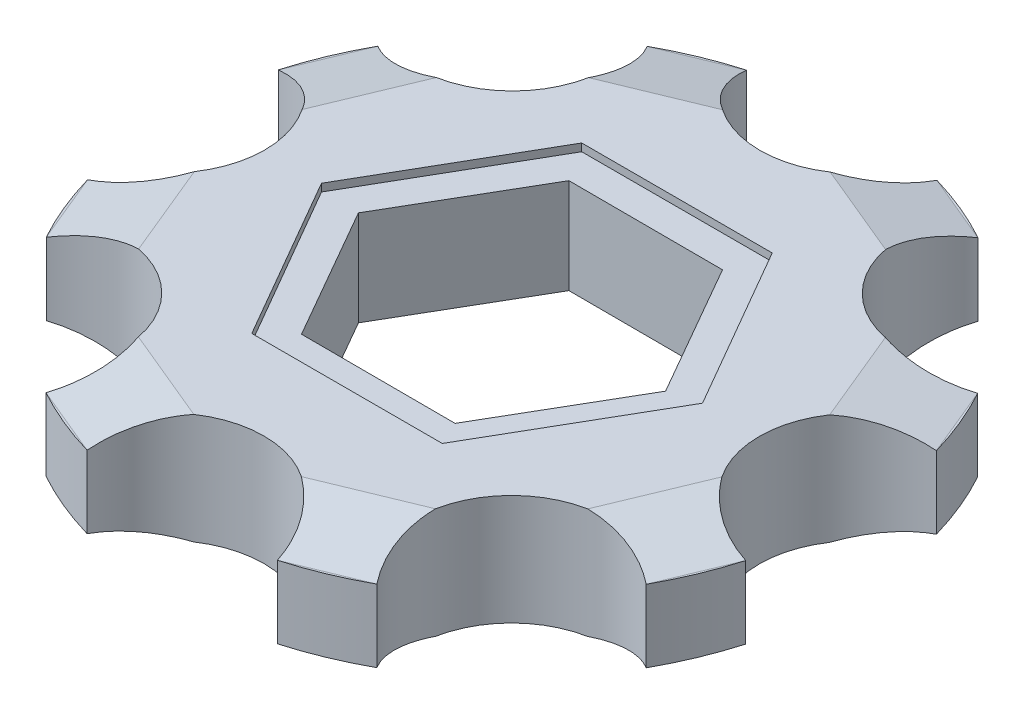
from build123d import *

# Parameters (mm, degrees)
SKETCH1_R                    = 9
BOSS_EXTRUDE2_DEPTH          = 2.9
CUT_EXTRUDE1_DEPTH           = 14.054118124
CUT_EXTRUDE2_DEPTH           = 0.2
CUT_EXTRUDE3_DEPTH           = 1.5
SKETCH12_W                   = 1.997814522
SKETCH12_H                   = 0.5
CUT_EXTRUDE6_DEPTH           = 1.5
CIRPATTERN1_COUNT            = 8
CIRPATTERN1_COPY_1_DEPTH     = 1.5
CIRPATTERN1_COPY_2_DEPTH     = 1.5
CIRPATTERN1_COPY_3_DEPTH     = 1.5
CIRPATTERN1_COPY_4_DEPTH     = 1.5
CIRPATTERN1_COPY_5_DEPTH     = 1.5
CIRPATTERN1_COPY_6_DEPTH     = 1.5
CIRPATTERN1_COPY_7_DEPTH     = 1.5
CIRPATTERN1_COPY_8_SKETCH_W  = 1.997814522
CIRPATTERN1_COPY_8_SKETCH_H  = 0.5
CIRPATTERN1_COPY_8_DEPTH     = 1.5
CIRPATTERN1_COPY_9_SKETCH_W  = 1.997814522
CIRPATTERN1_COPY_9_SKETCH_H  = 0.5
CIRPATTERN1_COPY_9_DEPTH     = 1.5
CIRPATTERN1_COPY_10_SKETCH_W = 1.997814522
CIRPATTERN1_COPY_10_SKETCH_H = 0.5
CIRPATTERN1_COPY_10_DEPTH    = 1.5
CIRPATTERN1_COPY_11_SKETCH_W = 1.997814522
CIRPATTERN1_COPY_11_SKETCH_H = 0.5
CIRPATTERN1_COPY_11_DEPTH    = 1.5
CIRPATTERN1_COPY_12_SKETCH_W = 1.997814522
CIRPATTERN1_COPY_12_SKETCH_H = 0.5
CIRPATTERN1_COPY_12_DEPTH    = 1.5
CIRPATTERN1_COPY_13_SKETCH_W = 1.997814522
CIRPATTERN1_COPY_13_SKETCH_H = 0.5
CIRPATTERN1_COPY_13_DEPTH    = 1.5
CIRPATTERN1_COPY_14_SKETCH_W = 1.997814522
CIRPATTERN1_COPY_14_SKETCH_H = 0.5
CIRPATTERN1_COPY_14_DEPTH    = 1.5


with BuildPart() as part:
    # Sketch1 → Boss-Extrude2 (new body)
    with BuildSketch(Plane(origin=(0, 0, 0), x_dir=(1, 0, 0), z_dir=(0, 1, 0))):
        Circle(SKETCH1_R)
    extrude(amount=BOSS_EXTRUDE2_DEPTH)

    # Sketch3 → Cut-Extrude1 (cut, through all)
    with BuildSketch(Plane(origin=(0, 2.9, 0), x_dir=(1, 0, 0), z_dir=(0, 1, 0))):
        Polygon((4.041437795, -0.01067145), (2.029960644, 3.494652074), (-2.011477151, 3.505323523), (-4.041437795, 0.01067145), (-2.029960644, -3.494652074), (2.011477151, -3.505323523), align=None)
        with BuildLine():
            ThreePointArc((2.509241746, 8.643130559), (0.009620352, 8.999994858), (-2.490758254, 8.648475202))
            ThreePointArc((-2.490758254, 8.648475202), (0.006948025, 6.499989244), (2.509241746, 8.643130559))
        make_face()
        with BuildLine():
            ThreePointArc((-7.876627514, 4.354163411), (-4.591273476, 4.601099467), (-4.337314374, 7.885918083))
            ThreePointArc((-4.337314374, 7.885918083), (-6.357154779, 6.370760011), (-7.876627514, 4.354163411))
        make_face()
        with BuildLine():
            ThreePointArc((7.885918083, 4.337314374), (6.370760011, 6.357154779), (4.354163411, 7.876627514))
            ThreePointArc((4.354163411, 7.876627514), (4.601099467, 4.591273476), (7.885918083, 4.337314374))
        make_face()
        with BuildLine():
            ThreePointArc((-8.648475202, -2.490758254), (-6.499989244, 0.006948025), (-8.643130559, 2.509241746))
            ThreePointArc((-8.643130559, 2.509241746), (-8.999994858, 0.009620352), (-8.648475202, -2.490758254))
        make_face()
        with BuildLine():
            ThreePointArc((8.643130559, -2.509241746), (8.999994858, -0.009620352), (8.648475202, 2.490758254))
            ThreePointArc((8.648475202, 2.490758254), (6.499989244, -0.006948025), (8.643130559, -2.509241746))
        make_face()
        with BuildLine():
            ThreePointArc((-4.354163411, -7.876627514), (-4.601099467, -4.591273476), (-7.885918083, -4.337314374))
            ThreePointArc((-7.885918083, -4.337314374), (-6.370760011, -6.357154779), (-4.354163411, -7.876627514))
        make_face()
        with BuildLine():
            ThreePointArc((4.337314374, -7.885918083), (6.357154779, -6.370760011), (7.876627514, -4.354163411))
            ThreePointArc((7.876627514, -4.354163411), (4.591273476, -4.601099467), (4.337314374, -7.885918083))
        make_face()
        with BuildLine():
            ThreePointArc((2.490758254, -8.648475202), (-0.006948025, -6.499989244), (-2.509241746, -8.643130559))
            ThreePointArc((-2.509241746, -8.643130559), (-0.009620352, -8.999994858), (2.490758254, -8.648475202))
        make_face()
    extrude(amount=-CUT_EXTRUDE1_DEPTH, mode=Mode.SUBTRACT)

    # Sketch4 → Cut-Extrude2 (cut)
    with BuildSketch(Plane(origin=(0, 2.9, 0), x_dir=(1, 0, 0), z_dir=(0, 1, 0))):
        Polygon((5, 0), (2.5, 4.330127019), (-2.5, 4.330127019), (-5, 0), (-2.5, -4.330127019), (2.5, -4.330127019), align=None)
    cut_extrude2 = extrude(amount=-CUT_EXTRUDE2_DEPTH, mode=Mode.SUBTRACT)

    # Mirror1: Cut-Extrude2 across plane
    add(cut_extrude2.mirror(Plane.ZX.offset(1.45)), mode=Mode.SUBTRACT)

    # Sketch11 → Cut-Extrude3 (cut, symmetric)
    with BuildSketch(Plane(origin=(0, 0, 0), x_dir=(-0.9242880657451368, 0, 0.3816956530026425), z_dir=(-0.3816956530026425, 0, -0.9242880657451368))):
        Polygon((8.944394014, 0.5), (6.944394014, 0), (8.944394014, 0), align=None)
    cut_extrude3 = extrude(amount=CUT_EXTRUDE3_DEPTH, both=True, mode=Mode.SUBTRACT)

    # Sketch12 → Cut-Extrude6 (cut)
    with BuildSketch(Plane(origin=(-8.267196643, 0, 3.414036314), x_dir=(0.38169565300264263, 0, 0.9242880657451368), z_dir=(-0.9242880657451369, 0, 0.3816956530026427))):
        with Locations((0, 0.25)):
            Rectangle(SKETCH12_W, SKETCH12_H)
    cut_extrude6 = extrude(amount=CUT_EXTRUDE6_DEPTH, mode=Mode.SUBTRACT)

    # Mirror4: Cut-Extrude3 across plane
    add(cut_extrude3.mirror(Plane.ZX.offset(1.45)), mode=Mode.SUBTRACT)

    # Mirror5: Cut-Extrude6 across plane
    add(cut_extrude6.mirror(Plane.ZX.offset(1.45)), mode=Mode.SUBTRACT)

    # CirPattern1: Cut-Extrude3, Cut-Extrude6 ×8 about axis
    cirpattern1_axis = Axis((0, 2.9, 0), (0, -1, 0))
    add([cut_extrude3.rotate(cirpattern1_axis, i * 360 / CIRPATTERN1_COUNT) for i in range(1, CIRPATTERN1_COUNT)], mode=Mode.SUBTRACT)
    add([cut_extrude6.rotate(cirpattern1_axis, i * 360 / CIRPATTERN1_COUNT) for i in range(1, CIRPATTERN1_COUNT)], mode=Mode.SUBTRACT)

    # CirPattern1 copy 1 sketch → CirPattern1 copy 1 (cut, symmetric)
    with BuildSketch(Plane(origin=(0, 2.9, 0), x_dir=(-0.9234699436457796, 0, -0.38367077447058767), z_dir=(0.38367077447058767, 0, -0.9234699436457796))):
        Polygon((8.944394014, -0.5), (6.944394014, 0), (8.944394014, 0), align=None)
    extrude(amount=CIRPATTERN1_COPY_1_DEPTH, both=True, mode=Mode.SUBTRACT)

    # CirPattern1 copy 2 sketch → CirPattern1 copy 2 (cut, symmetric)
    with BuildSketch(Plane(origin=(0, 2.9, 0), x_dir=(-0.3816956530026426, 0, -0.9242880657451368), z_dir=(0.9242880657451368, 0, -0.3816956530026426))):
        Polygon((8.944394014, -0.5), (6.944394014, 0), (8.944394014, 0), align=None)
    extrude(amount=CIRPATTERN1_COPY_2_DEPTH, both=True, mode=Mode.SUBTRACT)

    # CirPattern1 copy 3 sketch → CirPattern1 copy 3 (cut, symmetric)
    with BuildSketch(Plane(origin=(0, 2.9, 0), x_dir=(0.38367077447058767, 0, -0.9234699436457796), z_dir=(0.9234699436457796, 0, 0.38367077447058767))):
        Polygon((8.944394014, -0.5), (6.944394014, 0), (8.944394014, 0), align=None)
    extrude(amount=CIRPATTERN1_COPY_3_DEPTH, both=True, mode=Mode.SUBTRACT)

    # CirPattern1 copy 4 sketch → CirPattern1 copy 4 (cut, symmetric)
    with BuildSketch(Plane(origin=(0, 2.9, 0), x_dir=(0.9242880657451368, 0, -0.38169565300264263), z_dir=(0.38169565300264263, 0, 0.9242880657451368))):
        Polygon((8.944394014, -0.5), (6.944394014, 0), (8.944394014, 0), align=None)
    extrude(amount=CIRPATTERN1_COPY_4_DEPTH, both=True, mode=Mode.SUBTRACT)

    # CirPattern1 copy 5 sketch → CirPattern1 copy 5 (cut, symmetric)
    with BuildSketch(Plane(origin=(0, 2.9, 0), x_dir=(0.9234699436457797, 0, 0.3836707744705876), z_dir=(-0.3836707744705876, 0, 0.9234699436457797))):
        Polygon((8.944394014, -0.5), (6.944394014, 0), (8.944394014, 0), align=None)
    extrude(amount=CIRPATTERN1_COPY_5_DEPTH, both=True, mode=Mode.SUBTRACT)

    # CirPattern1 copy 6 sketch → CirPattern1 copy 6 (cut, symmetric)
    with BuildSketch(Plane(origin=(0, 2.9, 0), x_dir=(0.3816956530026427, 0, 0.9242880657451367), z_dir=(-0.9242880657451367, 0, 0.3816956530026427))):
        Polygon((8.944394014, -0.5), (6.944394014, 0), (8.944394014, 0), align=None)
    extrude(amount=CIRPATTERN1_COPY_6_DEPTH, both=True, mode=Mode.SUBTRACT)

    # CirPattern1 copy 7 sketch → CirPattern1 copy 7 (cut, symmetric)
    with BuildSketch(Plane(origin=(0, 2.9, 0), x_dir=(-0.3836707744705875, 0, 0.9234699436457796), z_dir=(-0.9234699436457796, 0, -0.3836707744705875))):
        Polygon((8.944394014, -0.5), (6.944394014, 0), (8.944394014, 0), align=None)
    extrude(amount=CIRPATTERN1_COPY_7_DEPTH, both=True, mode=Mode.SUBTRACT)

    # CirPattern1 copy 8 sketch → CirPattern1 copy 8 (cut)
    with BuildSketch(Plane(origin=(-8.259879036, 2.9, -3.431702579), x_dir=(-0.3836707744705876, 0, 0.9234699436457797), z_dir=(-0.9234699436457798, 0, -0.38367077447058767))):
        with Locations((0, -0.25)):
            Rectangle(CIRPATTERN1_COPY_8_SKETCH_W, CIRPATTERN1_COPY_8_SKETCH_H)
    extrude(amount=CIRPATTERN1_COPY_8_DEPTH, mode=Mode.SUBTRACT)

    # CirPattern1 copy 9 sketch → CirPattern1 copy 9 (cut)
    with BuildSketch(Plane(origin=(-3.414036314, 2.9, -8.267196643), x_dir=(-0.9242880657451368, 0, 0.3816956530026427), z_dir=(-0.38169565300264274, 0, -0.9242880657451369))):
        with Locations((0, -0.25)):
            Rectangle(CIRPATTERN1_COPY_9_SKETCH_W, CIRPATTERN1_COPY_9_SKETCH_H)
    extrude(amount=CIRPATTERN1_COPY_9_DEPTH, mode=Mode.SUBTRACT)

    # CirPattern1 copy 10 sketch → CirPattern1 copy 10 (cut)
    with BuildSketch(Plane(origin=(3.431702579, 2.9, -8.259879036), x_dir=(-0.9234699436457797, 0, -0.3836707744705876), z_dir=(0.38367077447058767, 0, -0.9234699436457798))):
        with Locations((0, -0.25)):
            Rectangle(CIRPATTERN1_COPY_10_SKETCH_W, CIRPATTERN1_COPY_10_SKETCH_H)
    extrude(amount=CIRPATTERN1_COPY_10_DEPTH, mode=Mode.SUBTRACT)

    # CirPattern1 copy 11 sketch → CirPattern1 copy 11 (cut)
    with BuildSketch(Plane(origin=(8.267196643, 2.9, -3.414036314), x_dir=(-0.38169565300264274, 0, -0.9242880657451368), z_dir=(0.9242880657451369, 0, -0.3816956530026428))):
        with Locations((0, -0.25)):
            Rectangle(CIRPATTERN1_COPY_11_SKETCH_W, CIRPATTERN1_COPY_11_SKETCH_H)
    extrude(amount=CIRPATTERN1_COPY_11_DEPTH, mode=Mode.SUBTRACT)

    # CirPattern1 copy 12 sketch → CirPattern1 copy 12 (cut)
    with BuildSketch(Plane(origin=(8.259879036, 2.9, 3.431702579), x_dir=(0.38367077447058756, 0, -0.9234699436457798), z_dir=(0.92346994364578, 0, 0.3836707744705876))):
        with Locations((0, -0.25)):
            Rectangle(CIRPATTERN1_COPY_12_SKETCH_W, CIRPATTERN1_COPY_12_SKETCH_H)
    extrude(amount=CIRPATTERN1_COPY_12_DEPTH, mode=Mode.SUBTRACT)

    # CirPattern1 copy 13 sketch → CirPattern1 copy 13 (cut)
    with BuildSketch(Plane(origin=(3.414036314, 2.9, 8.267196643), x_dir=(0.9242880657451367, 0, -0.3816956530026428), z_dir=(0.38169565300264285, 0, 0.9242880657451368))):
        with Locations((0, -0.25)):
            Rectangle(CIRPATTERN1_COPY_13_SKETCH_W, CIRPATTERN1_COPY_13_SKETCH_H)
    extrude(amount=CIRPATTERN1_COPY_13_DEPTH, mode=Mode.SUBTRACT)

    # CirPattern1 copy 14 sketch → CirPattern1 copy 14 (cut)
    with BuildSketch(Plane(origin=(-3.431702579, 2.9, 8.259879036), x_dir=(0.9234699436457798, 0, 0.38367077447058745), z_dir=(-0.3836707744705875, 0, 0.9234699436457798))):
        with Locations((0, -0.25)):
            Rectangle(CIRPATTERN1_COPY_14_SKETCH_W, CIRPATTERN1_COPY_14_SKETCH_H)
    extrude(amount=CIRPATTERN1_COPY_14_DEPTH, mode=Mode.SUBTRACT)


solid = part.part
